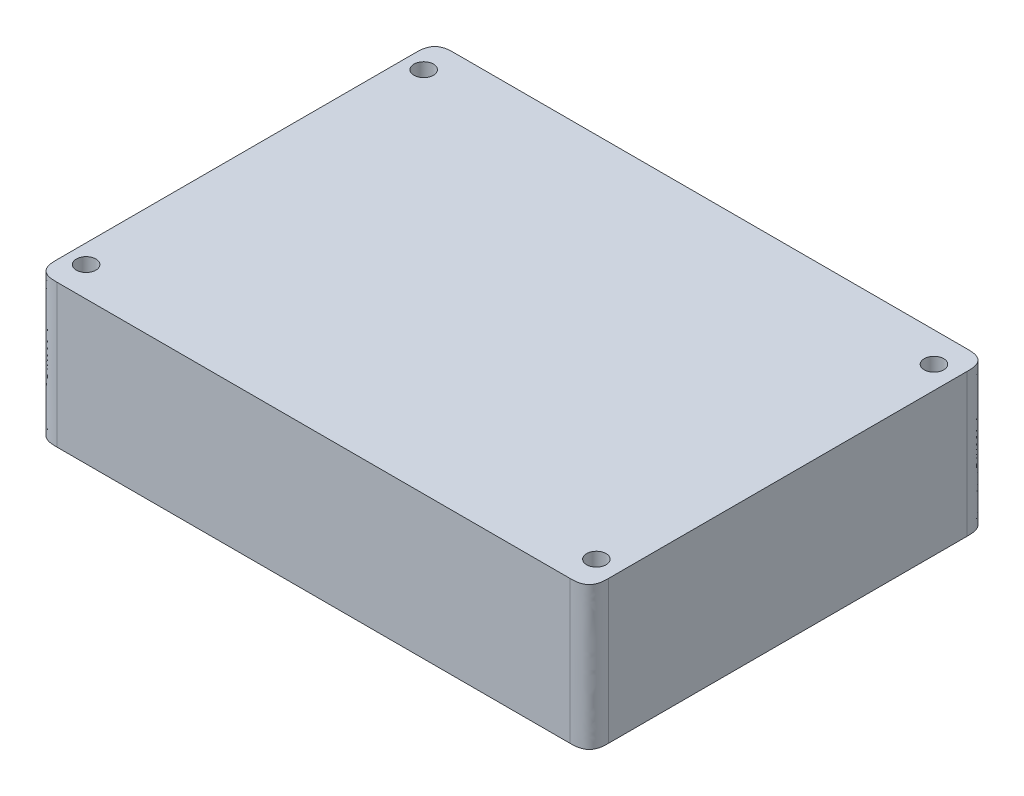
from build123d import *

# Parameters (mm, degrees)
SKETCH_1_W      = 85
SKETCH_1_H      = 61.2
SKETCH_1_R      = 1.5
EXTRUDE_1_DEPTH = 22
FILLET_1_SIZE   = 3


with BuildPart() as part:
    # 草图1 → 凸台-拉伸1 (new body)
    with BuildSketch(Plane(origin=(0, 0, 0), x_dir=(1, 0, 0), z_dir=(0, 1, 0))):
        with Locations((-11.752972973, -4.383243243)):
            Rectangle(SKETCH_1_W, SKETCH_1_H)
        with Locations(Location((-51.352972973, 21.616756757, 0), (0, 0, 270))):
            Circle(SKETCH_1_R, mode=Mode.SUBTRACT)
        with Locations(Location((-51.352972973, -30.383243243, 0), (0, 0, 270))):
            Circle(SKETCH_1_R, mode=Mode.SUBTRACT)
        with Locations(Location((27.247027027, 21.616756757, 0), (0, 0, 270))):
            Circle(SKETCH_1_R, mode=Mode.SUBTRACT)
        with Locations(Location((27.247027027, -30.383243243, 0), (0, 0, 270))):
            Circle(SKETCH_1_R, mode=Mode.SUBTRACT)
    extrude(amount=EXTRUDE_1_DEPTH)

    # 圆角1
    # a fillet whose section is not a circle: 3 mm, written as the material it takes off along each edge
    with BuildSketch(Plane(origin=(-54.252972973, -7.5, -26.216756757), x_dir=(1, 0, 0), z_dir=(0, 1, 0))) as fillet_1_piece_1:
        with BuildLine():
            add(Edge.make_bspline([(FILLET_1_SIZE, 0), (FILLET_1_SIZE * 0.831801948466, 0), (FILLET_1_SIZE * 0.663603896932, 0), (FILLET_1_SIZE * 0.292893218813, -FILLET_1_SIZE * 0.0716919198361), (FILLET_1_SIZE * 0.0716919198361, -FILLET_1_SIZE * 0.292893218813), (0, -FILLET_1_SIZE * 0.663603896932), (0, -FILLET_1_SIZE * 0.831801948466), (0, -FILLET_1_SIZE)], knots=[0, 0, 0, 0, 0, 0, 0.5, 0.5, 1, 1, 1, 1, 1, 1], degree=5))
            Line((0, -FILLET_1_SIZE), (0, 0))
            Line((0, 0), (FILLET_1_SIZE, 0))
        make_face()
    extrude(amount=37, mode=Mode.SUBTRACT)
    with BuildSketch(Plane(origin=(30.747027027, -7.5, -26.216756757), x_dir=(-1, 0, 0), z_dir=(0, 1, 0)), Plane(origin=(-54.252972973, -7.5, 34.983243243), x_dir=(1, 0, 0), z_dir=(0, 1, 0)), Plane(origin=(30.747027027, -7.5, 34.983243243), x_dir=(0, 0, -1), z_dir=(0, 1, 0))) as fillet_1_piece_2:
        with BuildLine():
            add(Edge.make_bspline([(FILLET_1_SIZE, 0), (FILLET_1_SIZE * 0.831801948466, 0), (FILLET_1_SIZE * 0.663603896932, 0), (FILLET_1_SIZE * 0.292893218813, FILLET_1_SIZE * 0.0716919198361), (FILLET_1_SIZE * 0.0716919198361, FILLET_1_SIZE * 0.292893218813), (0, FILLET_1_SIZE * 0.663603896932), (0, FILLET_1_SIZE * 0.831801948466), (0, FILLET_1_SIZE)], knots=[0, 0, 0, 0, 0, 0, 0.5, 0.5, 1, 1, 1, 1, 1, 1], degree=5))
            Line((0, FILLET_1_SIZE), (0, 0))
            Line((0, 0), (FILLET_1_SIZE, 0))
        make_face()
    extrude(amount=37, mode=Mode.SUBTRACT)


solid = part.part
